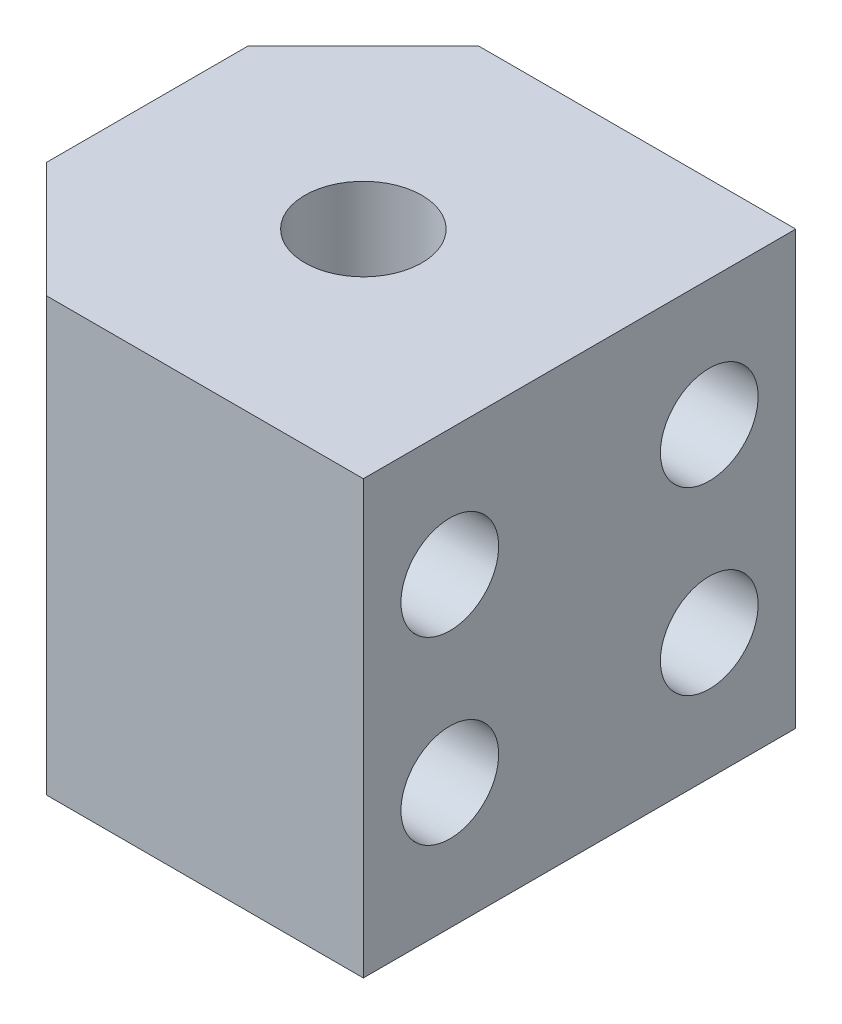
from build123d import *

# Parameters (mm, degrees)
SKETCH1_W                                     = 19.05
SKETCH1_H                                     = 19.05
BOSS_EXTRUDE1_DEPTH                           = 19.05
TAPPED_HOLE_FOR_10_24_HELICOIL1_D             = 5.15874
CSK_FOR_6_FLAT_HEAD_MACHINE_SCREW1_AT_2_COUNT = 2
CSK_FOR_6_FLAT_HEAD_MACHINE_SCREW1_AT_2_PITCH = 7.9375
CSK_FOR_6_FLAT_HEAD_MACHINE_SCREW1_AT_3_COUNT = 2
CSK_FOR_6_FLAT_HEAD_MACHINE_SCREW1_AT_3_PITCH = 13.915775446
CSK_FOR_6_FLAT_HEAD_MACHINE_SCREW1_AT_4_COUNT = 2
CSK_FOR_6_FLAT_HEAD_MACHINE_SCREW1_AT_4_PITCH = 11.43
CHAMFER2_SIZE                                 = 5.08


with BuildPart() as part:
    # Sketch1 → Boss-Extrude1 (new body)
    with BuildSketch(Plane(origin=(0, 0, 0), x_dir=(1, 0, 0), z_dir=(0, 1, 0))):
        Rectangle(SKETCH1_W, SKETCH1_H)
    extrude(amount=BOSS_EXTRUDE1_DEPTH)

    # Tapped Hole for #10-24 Helicoil1 (through all)
    with Locations(Plane.XZ):
        with Locations((0, 0)):
            Hole(TAPPED_HOLE_FOR_10_24_HELICOIL1_D / 2)

    # Sketch5 → CSK for #6 Flat Head Machine Screw1 (revolve, cut)
    with BuildSketch(Plane(origin=(-9.525, 5.55625, 5.715), x_dir=(0, 0, 1), z_dir=(0, 1, 0))):
        Polygon((0, 0), (0, 19.05), (2.15265, 19.05), (2.15265, 6.679759826), (3.5433, 5.08), (3.5433, 0), align=None)
    csk_for_6_flat_head_machine_screw1 = revolve(axis=Axis((-15.875, 5.55625, 5.715), (1, 0, 0)), mode=Mode.SUBTRACT)

    # CSK for #6 Flat Head Machine Screw1 at 2: CSK for #6 Flat Head Machine Screw1 ×2
    with Locations(*[(0, i * CSK_FOR_6_FLAT_HEAD_MACHINE_SCREW1_AT_2_PITCH, 0) for i in range(1, CSK_FOR_6_FLAT_HEAD_MACHINE_SCREW1_AT_2_COUNT)]):
        add(csk_for_6_flat_head_machine_screw1, mode=Mode.SUBTRACT)

    # CSK for #6 Flat Head Machine Screw1 at 3: CSK for #6 Flat Head Machine Screw1 ×2
    with Locations(*[Vector(0, 0.5703958094953442, -0.8213699656732957) * (i * CSK_FOR_6_FLAT_HEAD_MACHINE_SCREW1_AT_3_PITCH) for i in range(1, CSK_FOR_6_FLAT_HEAD_MACHINE_SCREW1_AT_3_COUNT)]):
        add(csk_for_6_flat_head_machine_screw1, mode=Mode.SUBTRACT)

    # CSK for #6 Flat Head Machine Screw1 at 4: CSK for #6 Flat Head Machine Screw1 ×2
    with Locations(*[(0, 0, -i * CSK_FOR_6_FLAT_HEAD_MACHINE_SCREW1_AT_4_PITCH) for i in range(1, CSK_FOR_6_FLAT_HEAD_MACHINE_SCREW1_AT_4_COUNT)]):
        add(csk_for_6_flat_head_machine_screw1, mode=Mode.SUBTRACT)

    # Chamfer2
    # the kernel refuses this chamfer: 5.08 mm, written as the material it takes off along each edge
    with BuildSketch(Plane(origin=(-9.525, -13.064149579, -9.525), x_dir=(0.9996219169112966, 0, -0.02749587661058626), z_dir=(0, 1, 0)), Plane(origin=(-9.525, -13.064149579, 9.525), x_dir=(-0.02749587661058626, 0, -0.9996219169112968), z_dir=(0, 1, 0))) as chamfer2_piece_1:
        Polygon((CHAMFER2_SIZE * 0.999621916911, -CHAMFER2_SIZE * 0.0274958766106), (-CHAMFER2_SIZE * 0.0274958766106, -CHAMFER2_SIZE * 0.999621916911), (0, 0), align=None)
    extrude(amount=45.178299158, mode=Mode.SUBTRACT)


solid = part.part
